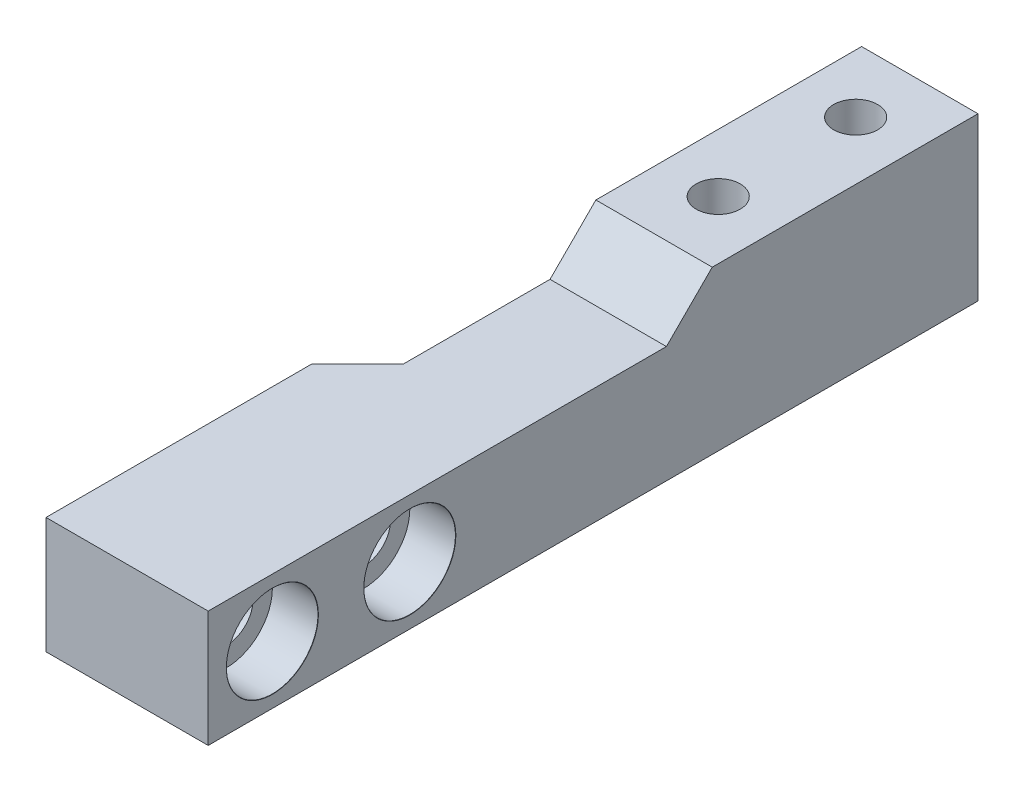
from build123d import *

# Parameters (mm, degrees)
SKETCH2_W                     = 12.7
SKETCH2_H                     = 84
BOSS_EXTRUDE1_DEPTH           = 12.7
SKETCH5_W                     = 12.7
SKETCH5_H                     = 29
BOSS_EXTRUDE2_DEPTH           = 5
CBORE_FOR_M4_SHCS1_AT_2_COUNT = 2
CBORE_FOR_M4_SHCS1_AT_2_PITCH = 15
SKETCH8_W                     = 29
SKETCH8_H                     = 12.7
BOSS_EXTRUDE3_DEPTH           = 5
CBORE_FOR_M5_SHCS2_AT_2_COUNT = 2
CBORE_FOR_M5_SHCS2_AT_2_PITCH = 15
CHAMFER1_SIZE                 = 5


with BuildPart() as part:
    # Sketch2 → Boss-Extrude1 (new body)
    with BuildSketch(Plane(origin=(0, 0, 0), x_dir=(1, 0, 0), z_dir=(0, 1, 0))):
        Rectangle(SKETCH2_W, SKETCH2_H)
    extrude(amount=BOSS_EXTRUDE1_DEPTH)

    # Sketch5 → Boss-Extrude2 (add)
    with BuildSketch(Plane(origin=(0, 12.7, 0), x_dir=(1, 0, 0), z_dir=(0, 1, 0))):
        with Locations((0, 27.5)):
            Rectangle(SKETCH5_W, SKETCH5_H)
    extrude(amount=BOSS_EXTRUDE2_DEPTH)

    # Sketch4 → CBORE for M4 SHCS1 (revolve, cut)
    with BuildSketch(Plane(origin=(0, 0, -35), x_dir=(0, 0, -1), z_dir=(1, 0, 0))):
        Polygon((0, 0), (0, 17.7), (2.4, 17.7), (2.4, 4), (4, 4), (4, 0.020977491), (4.025, 0), align=None)
    cbore_for_m4_shcs1 = revolve(axis=Axis((0, -6.35, -35), (0, 1, 0)), mode=Mode.SUBTRACT)

    # CBORE for M4 SHCS1 at 2: CBORE for M4 SHCS1 ×2
    with Locations(*[(0, 0, i * CBORE_FOR_M4_SHCS1_AT_2_PITCH) for i in range(1, CBORE_FOR_M4_SHCS1_AT_2_COUNT)]):
        add(cbore_for_m4_shcs1, mode=Mode.SUBTRACT)

    # Sketch8 → Boss-Extrude3 (add)
    with BuildSketch(Plane.ZY.offset(6.35)):
        with Locations((27.5, 6.35)):
            Rectangle(SKETCH8_W, SKETCH8_H)
    extrude(amount=BOSS_EXTRUDE3_DEPTH)

    # Sketch7 → CBORE for M5 SHCS2 (revolve, cut)
    with BuildSketch(Plane(origin=(6.35, 6.35, 35), x_dir=(0, 0, -1), z_dir=(0, 1, 0))):
        Polygon((0, 0), (0, 17.7), (2.9, 17.7), (2.9, 5), (5, 5), (5, 0.020977491), (5.025, 0), align=None)
    cbore_for_m5_shcs2 = revolve(axis=Axis((12.7, 6.35, 35), (-1, 0, 0)), mode=Mode.SUBTRACT)

    # CBORE for M5 SHCS2 at 2: CBORE for M5 SHCS2 ×2
    with Locations(*[(0, 0, -i * CBORE_FOR_M5_SHCS2_AT_2_PITCH) for i in range(1, CBORE_FOR_M5_SHCS2_AT_2_COUNT)]):
        add(cbore_for_m5_shcs2, mode=Mode.SUBTRACT)

    # Chamfer1
    chamfer1_edges = [part.edges().sort_by_distance(p)[0] for p in [
        (0, 12.7, -13),
        (-6.35, 6.35, 13),
    ]]
    chamfer(chamfer1_edges, length=CHAMFER1_SIZE - 0.0001)  # a hair under: the kernel refuses the full size


solid = part.part
